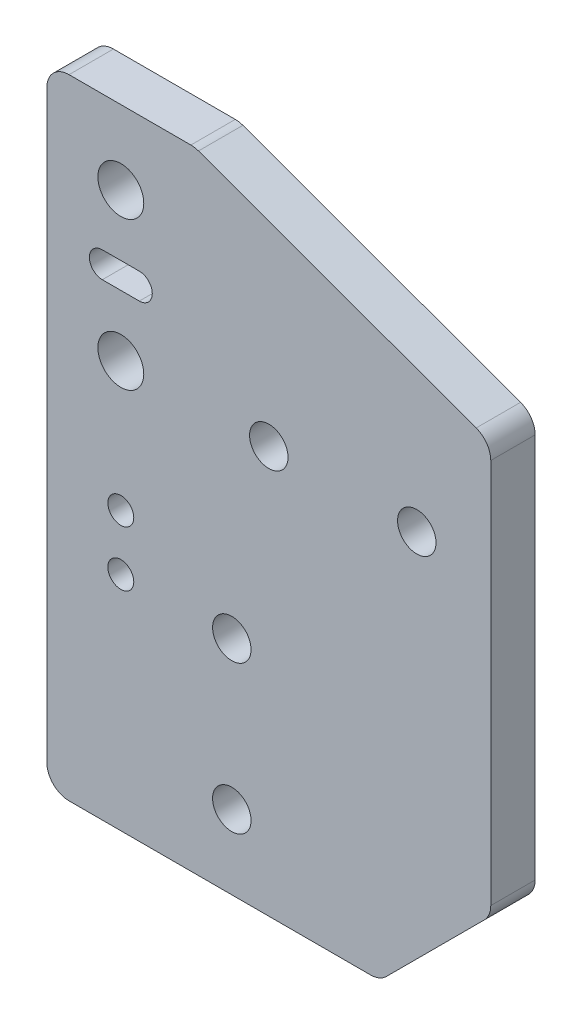
from build123d import *

# Parameters (mm, degrees)
MODEL_R                  = 3.1
MODEL_R_2                = 2.6
BODY_DEPTH               = 6
SKETCH1_R                = 1.75
FORSENSOR_DEPTH          = 10
F_5_1_5_1_FOOTINGMOUNT_D = 5.2


with BuildPart() as part:
    # Model (on Front Plane) → Body (new body)
    with BuildSketch(Plane.XY):
        with BuildLine():
            Line((59.121320344, 14.121320344), (45.878679656, 0.878679656))
            ThreePointArc((45.878679656, 0.878679656), (44.90540961, 0.228361402), (43.757359313, 0))
            Line((43.757359313, 0), (3, 0))
            ThreePointArc((3, 0), (0.878679656, 0.878679656), (0, 3))
            Line((0, 3), (0, 82))
            ThreePointArc((0, 82), (0.878679656, 84.121320344), (3, 85))
            Line((3, 85), (19.471019058, 85))
            ThreePointArc((19.471019058, 85), (19.991963591, 84.954423259), (20.497079488, 84.819077862))
            Line((20.497079488, 84.819077862), (58.02606043, 71.159645877))
            ThreePointArc((58.02606043, 71.159645877), (59.457456133, 70.061297324), (60, 68.340568015))
            Line((60, 68.340568015), (60, 16.242640687))
            ThreePointArc((60, 16.242640687), (59.771638598, 15.09459039), (59.121320344, 14.121320344))
        make_face()
        with Locations((10, 75)):
            Circle(MODEL_R, mode=Mode.SUBTRACT)
        with Locations((10, 55)):
            Circle(MODEL_R, mode=Mode.SUBTRACT)
        with Locations((30, 55)):
            Circle(MODEL_R_2, mode=Mode.SUBTRACT)
        with Locations((50, 55)):
            Circle(MODEL_R_2, mode=Mode.SUBTRACT)
        with BuildLine():
            Line((12.5, 63.25), (7.5, 63.25))
            ThreePointArc((7.5, 63.25), (5.75, 65), (7.5, 66.75))
            Line((7.5, 66.75), (12.5, 66.75))
            ThreePointArc((12.5, 66.75), (14.25, 65), (12.5, 63.25))
        make_face(mode=Mode.SUBTRACT)
    extrude(amount=BODY_DEPTH)

    # Sketch1 → ForSensor (cut)
    with BuildSketch(Plane(origin=(0, 0, 0), x_dir=(-1, 0, 0), z_dir=(0, 0, -1))):
        with Locations((-10, 30)):
            Circle(SKETCH1_R)
        with Locations((-10, 37.5)):
            Circle(SKETCH1_R)
    extrude(amount=-FORSENSOR_DEPTH, mode=Mode.SUBTRACT)

    # Ø5.1 (5.1) FootingMount (through all)
    with Locations(Plane.XY.offset(6)):
        with Locations((25, 10), (25, 30)):
            Hole(F_5_1_5_1_FOOTINGMOUNT_D / 2)


solid = part.part
